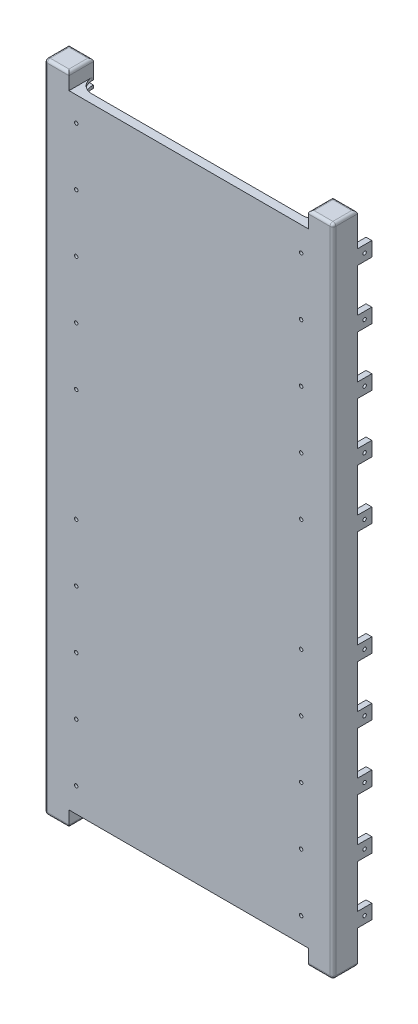
from build123d import *

# Parameters (mm, degrees)
BOSS_EXTRUDE1_DEPTH             = 227
FILLET1_R                       = 1
SKETCH2_W                       = 2
SKETCH2_H                       = 5
BOSS_EXTRUDE2_DEPTH             = 5
BOSS_EXTRUDE6_START             = -41.5
SKETCH13_W                      = 0.2
SKETCH13_H                      = 214
BOSS_EXTRUDE6_DEPTH             = 41.5
F_0_80_TAPPED_HOLE1_AT_2_COUNT  = 2
F_0_80_TAPPED_HOLE1_AT_2_PITCH  = 20
F_0_80_TAPPED_HOLE1_AT_3_COUNT  = 2
F_0_80_TAPPED_HOLE1_AT_3_PITCH  = 40
F_0_80_TAPPED_HOLE1_AT_4_COUNT  = 2
F_0_80_TAPPED_HOLE1_AT_4_PITCH  = 60
F_0_80_TAPPED_HOLE1_AT_5_COUNT  = 2
F_0_80_TAPPED_HOLE1_AT_5_PITCH  = 80
F_0_80_TAPPED_HOLE1_AT_6_COUNT  = 2
F_0_80_TAPPED_HOLE1_AT_6_PITCH  = 119
F_0_80_TAPPED_HOLE1_AT_7_COUNT  = 2
F_0_80_TAPPED_HOLE1_AT_7_PITCH  = 139
F_0_80_TAPPED_HOLE1_AT_8_COUNT  = 2
F_0_80_TAPPED_HOLE1_AT_8_PITCH  = 159
F_0_80_TAPPED_HOLE1_AT_9_COUNT  = 2
F_0_80_TAPPED_HOLE1_AT_9_PITCH  = 179
F_0_80_TAPPED_HOLE1_AT_10_COUNT = 2
F_0_80_TAPPED_HOLE1_AT_10_PITCH = 199
FILLET2_R                       = 2.5
CUT_EXTRUDE1_START              = -6.5
SKETCH3_W                       = 6.5
SKETCH3_H                       = 6.5
CUT_EXTRUDE1_DEPTH              = 214
MIRROR7_COPY_10_SKETCH_W        = 2
MIRROR7_COPY_10_SKETCH_H        = 5
MIRROR7_COPY_10_DEPTH           = 5
FILLET1_OF_MIRROR7_R            = 1
FILLET2_OF_MIRROR7_R            = 2.5
SKETCH14_W                      = 8.5
SKETCH14_H                      = 1
BOSS_EXTRUDE7_DEPTH             = 96
CUT_EXTRUDE2_DEPTH              = 242.486800882


with BuildPart() as part:
    # Sketch1 → Boss-Extrude1 (new body)
    with BuildSketch(Plane(origin=(0, 0, 0), x_dir=(1, 0, 0), z_dir=(0, 1, 0))):
        with BuildLine():
            Line((-3.25, -4.25), (4.25, -4.25))
            Line((4.25, -4.25), (4.25, 4.25))
            Line((4.25, 4.25), (-4.25, 4.25))
            Line((-4.25, 4.25), (-4.25, -3.25))
            ThreePointArc((-4.25, -3.25), (-3.957106781, -3.957106781), (-3.25, -4.25))
        make_face()
    boss_extrude1 = extrude(amount=BOSS_EXTRUDE1_DEPTH)

    # Fillet1
    fillet1_edges = [part.edges().sort_by_distance(p)[0] for p in [
        (-4.25, 227, -0.5),
        (-3.957106781, 227, 3.957106781),
        (0.5, 227, 4.25),
        (4.25, 227, 0),
        (0.5, 0, 4.25),
        (-3.957106781, 0, 3.957106781),
        (-4.25, 0, -0.5),
        (0, 0, -4.25),
        (4.25, 0, 0),
        (0, 227, -4.25),
    ]]
    fillet(fillet1_edges, radius=FILLET1_R)

    # Sketch2 → Boss-Extrude2 (add)
    with BuildSketch(Plane(origin=(4.25, 0, 0), x_dir=(0, 0, -1), z_dir=(1, 0, 0))):
        with Locations((-3.25, 213)):
            Rectangle(SKETCH2_W, SKETCH2_H)
        with Locations((-3.25, 193)):
            Rectangle(SKETCH2_W, SKETCH2_H)
        with Locations((-3.25, 173)):
            Rectangle(SKETCH2_W, SKETCH2_H)
        with Locations((-3.25, 153)):
            Rectangle(SKETCH2_W, SKETCH2_H)
        with Locations((-3.25, 133)):
            Rectangle(SKETCH2_W, SKETCH2_H)
        with Locations((-3.25, 94)):
            Rectangle(SKETCH2_W, SKETCH2_H)
        with Locations((-3.25, 74)):
            Rectangle(SKETCH2_W, SKETCH2_H)
        with Locations((-3.25, 54)):
            Rectangle(SKETCH2_W, SKETCH2_H)
        with Locations((-3.25, 34)):
            Rectangle(SKETCH2_W, SKETCH2_H)
        with Locations((-3.25, 14)):
            Rectangle(SKETCH2_W, SKETCH2_H)
    boss_extrude2 = extrude(amount=BOSS_EXTRUDE2_DEPTH)

    # Sketch13 → Boss-Extrude6 (add)
    with BuildSketch(Plane.ZY.offset(-4.25).offset(BOSS_EXTRUDE6_START)):
        with Locations((4.15, 113.5)):
            Rectangle(SKETCH13_W, SKETCH13_H)
    boss_extrude6 = extrude(amount=BOSS_EXTRUDE6_DEPTH)

    # Sketch11 → #0-80 Tapped Hole1 (revolve, cut)
    with BuildSketch(Plane(origin=(6.75, 213, 4.25), x_dir=(0, -1, 0), z_dir=(1, 0, 0))):
        Polygon((0, 0), (0, 4.358390611), (0.59563, 4.0005), (0.59563, 0), align=None)
    f_0_80_tapped_hole1 = revolve(axis=Axis((6.75, 213, 10.6), (0, 0, -1)), mode=Mode.SUBTRACT)

    # #0-80 Tapped Hole1 at 2: #0-80 Tapped Hole1 ×2
    with Locations(*[(0, -i * F_0_80_TAPPED_HOLE1_AT_2_PITCH, 0) for i in range(1, F_0_80_TAPPED_HOLE1_AT_2_COUNT)]):
        add(f_0_80_tapped_hole1, mode=Mode.SUBTRACT)

    # #0-80 Tapped Hole1 at 3: #0-80 Tapped Hole1 ×2
    with Locations(*[(0, -i * F_0_80_TAPPED_HOLE1_AT_3_PITCH, 0) for i in range(1, F_0_80_TAPPED_HOLE1_AT_3_COUNT)]):
        add(f_0_80_tapped_hole1, mode=Mode.SUBTRACT)

    # #0-80 Tapped Hole1 at 4: #0-80 Tapped Hole1 ×2
    with Locations(*[(0, -i * F_0_80_TAPPED_HOLE1_AT_4_PITCH, 0) for i in range(1, F_0_80_TAPPED_HOLE1_AT_4_COUNT)]):
        add(f_0_80_tapped_hole1, mode=Mode.SUBTRACT)

    # #0-80 Tapped Hole1 at 5: #0-80 Tapped Hole1 ×2
    with Locations(*[(0, -i * F_0_80_TAPPED_HOLE1_AT_5_PITCH, 0) for i in range(1, F_0_80_TAPPED_HOLE1_AT_5_COUNT)]):
        add(f_0_80_tapped_hole1, mode=Mode.SUBTRACT)

    # #0-80 Tapped Hole1 at 6: #0-80 Tapped Hole1 ×2
    with Locations(*[(0, -i * F_0_80_TAPPED_HOLE1_AT_6_PITCH, 0) for i in range(1, F_0_80_TAPPED_HOLE1_AT_6_COUNT)]):
        add(f_0_80_tapped_hole1, mode=Mode.SUBTRACT)

    # #0-80 Tapped Hole1 at 7: #0-80 Tapped Hole1 ×2
    with Locations(*[(0, -i * F_0_80_TAPPED_HOLE1_AT_7_PITCH, 0) for i in range(1, F_0_80_TAPPED_HOLE1_AT_7_COUNT)]):
        add(f_0_80_tapped_hole1, mode=Mode.SUBTRACT)

    # #0-80 Tapped Hole1 at 8: #0-80 Tapped Hole1 ×2
    with Locations(*[(0, -i * F_0_80_TAPPED_HOLE1_AT_8_PITCH, 0) for i in range(1, F_0_80_TAPPED_HOLE1_AT_8_COUNT)]):
        add(f_0_80_tapped_hole1, mode=Mode.SUBTRACT)

    # #0-80 Tapped Hole1 at 9: #0-80 Tapped Hole1 ×2
    with Locations(*[(0, -i * F_0_80_TAPPED_HOLE1_AT_9_PITCH, 0) for i in range(1, F_0_80_TAPPED_HOLE1_AT_9_COUNT)]):
        add(f_0_80_tapped_hole1, mode=Mode.SUBTRACT)

    # #0-80 Tapped Hole1 at 10: #0-80 Tapped Hole1 ×2
    with Locations(*[(0, -i * F_0_80_TAPPED_HOLE1_AT_10_PITCH, 0) for i in range(1, F_0_80_TAPPED_HOLE1_AT_10_COUNT)]):
        add(f_0_80_tapped_hole1, mode=Mode.SUBTRACT)

    # Fillet2
    fillet2_edges = [part.edges().sort_by_distance(p)[0] for p in [
        (4.25, 215.5, 3.15),
    ]]
    fillet(fillet2_edges, radius=FILLET2_R)
    fillet2_2_edges = [part.edges().sort_by_distance(p)[0] for p in [
        (4.25, 195.5, 3.15),
    ]]
    fillet(fillet2_2_edges, radius=FILLET2_R)
    fillet2_3_edges = [part.edges().sort_by_distance(p)[0] for p in [
        (4.25, 175.5, 3.15),
    ]]
    fillet(fillet2_3_edges, radius=FILLET2_R)
    fillet2_4_edges = [part.edges().sort_by_distance(p)[0] for p in [
        (4.25, 155.5, 3.15),
    ]]
    fillet(fillet2_4_edges, radius=FILLET2_R)
    fillet2_5_edges = [part.edges().sort_by_distance(p)[0] for p in [
        (4.25, 135.5, 3.15),
    ]]
    fillet(fillet2_5_edges, radius=FILLET2_R)
    fillet2_6_edges = [part.edges().sort_by_distance(p)[0] for p in [
        (4.25, 91.5, 3.15),
    ]]
    fillet(fillet2_6_edges, radius=FILLET2_R)
    fillet2_7_edges = [part.edges().sort_by_distance(p)[0] for p in [
        (4.25, 71.5, 3.15),
    ]]
    fillet(fillet2_7_edges, radius=FILLET2_R)
    fillet2_8_edges = [part.edges().sort_by_distance(p)[0] for p in [
        (4.25, 51.5, 3.15),
    ]]
    fillet(fillet2_8_edges, radius=FILLET2_R)
    fillet2_9_edges = [part.edges().sort_by_distance(p)[0] for p in [
        (4.25, 31.5, 3.15),
    ]]
    fillet(fillet2_9_edges, radius=FILLET2_R)
    fillet2_10_edges = [part.edges().sort_by_distance(p)[0] for p in [
        (4.25, 11.5, 3.15),
    ]]
    fillet(fillet2_10_edges, radius=FILLET2_R)
    fillet2_11_edges = [part.edges().sort_by_distance(p)[0] for p in [
        (9.25, 215.5, 3.15),
    ]]
    fillet(fillet2_11_edges, radius=FILLET2_R - 0.0001)  # a hair under: the kernel refuses the full size
    fillet2_12_edges = [part.edges().sort_by_distance(p)[0] for p in [
        (9.25, 195.5, 3.15),
    ]]
    fillet(fillet2_12_edges, radius=FILLET2_R - 0.0001)  # a hair under: the kernel refuses the full size
    fillet2_13_edges = [part.edges().sort_by_distance(p)[0] for p in [
        (9.25, 175.5, 3.15),
    ]]
    fillet(fillet2_13_edges, radius=FILLET2_R - 0.0001)  # a hair under: the kernel refuses the full size
    fillet2_14_edges = [part.edges().sort_by_distance(p)[0] for p in [
        (9.25, 155.5, 3.15),
    ]]
    fillet(fillet2_14_edges, radius=FILLET2_R - 0.0001)  # a hair under: the kernel refuses the full size
    fillet2_15_edges = [part.edges().sort_by_distance(p)[0] for p in [
        (9.25, 135.5, 3.15),
    ]]
    fillet(fillet2_15_edges, radius=FILLET2_R - 0.0001)  # a hair under: the kernel refuses the full size
    fillet2_16_edges = [part.edges().sort_by_distance(p)[0] for p in [
        (9.25, 91.5, 3.15),
    ]]
    fillet(fillet2_16_edges, radius=FILLET2_R - 0.0001)  # a hair under: the kernel refuses the full size
    fillet2_17_edges = [part.edges().sort_by_distance(p)[0] for p in [
        (9.25, 71.5, 3.15),
    ]]
    fillet(fillet2_17_edges, radius=FILLET2_R - 0.0001)  # a hair under: the kernel refuses the full size
    fillet2_18_edges = [part.edges().sort_by_distance(p)[0] for p in [
        (9.25, 51.5, 3.15),
    ]]
    fillet(fillet2_18_edges, radius=FILLET2_R - 0.0001)  # a hair under: the kernel refuses the full size
    fillet2_19_edges = [part.edges().sort_by_distance(p)[0] for p in [
        (9.25, 31.5, 3.15),
    ]]
    fillet(fillet2_19_edges, radius=FILLET2_R - 0.0001)  # a hair under: the kernel refuses the full size
    fillet2_20_edges = [part.edges().sort_by_distance(p)[0] for p in [
        (9.25, 11.5, 3.15),
    ]]
    fillet(fillet2_20_edges, radius=FILLET2_R - 0.0001)  # a hair under: the kernel refuses the full size

    # Mirror1: Boss-Extrude2, #0-80 Tapped Hole1 across plane
    add(boss_extrude2.mirror(Plane(origin=(0, 0, 0), x_dir=(-0.7071067811865478, 0, 0.7071067811865472), z_dir=(-0.7071067811865475, 0, -0.7071067811865477))))
    add(f_0_80_tapped_hole1.mirror(Plane(origin=(0, 0, 0), x_dir=(-0.7071067811865478, 0, 0.7071067811865472), z_dir=(-0.7071067811865475, 0, -0.7071067811865477))), mode=Mode.SUBTRACT)

    # Mirror1 copy 1 sketch → Mirror1 copy 1 (revolve, cut)
    with BuildSketch(Plane(origin=(-4.25, 193, -6.75), x_dir=(0, -1, 0), z_dir=(0, 0, -1))):
        Polygon((0, 0), (0, -4.358390611), (0.59563, -4.0005), (0.59563, 0), align=None)
    revolve(axis=Axis((-10.6, 193, -6.75), (-1, 0, 0)), mode=Mode.SUBTRACT)

    # Mirror1 copy 2 sketch → Mirror1 copy 2 (revolve, cut)
    with BuildSketch(Plane(origin=(-4.25, 173, -6.75), x_dir=(0, -1, 0), z_dir=(0, 0, -1))):
        Polygon((0, 0), (0, -4.358390611), (0.59563, -4.0005), (0.59563, 0), align=None)
    revolve(axis=Axis((-10.6, 173, -6.75), (-1, 0, 0)), mode=Mode.SUBTRACT)

    # Mirror1 copy 3 sketch → Mirror1 copy 3 (revolve, cut)
    with BuildSketch(Plane(origin=(-4.25, 153, -6.75), x_dir=(0, -1, 0), z_dir=(0, 0, -1))):
        Polygon((0, 0), (0, -4.358390611), (0.59563, -4.0005), (0.59563, 0), align=None)
    revolve(axis=Axis((-10.6, 153, -6.75), (-1, 0, 0)), mode=Mode.SUBTRACT)

    # Mirror1 copy 4 sketch → Mirror1 copy 4 (revolve, cut)
    with BuildSketch(Plane(origin=(-4.25, 133, -6.75), x_dir=(0, -1, 0), z_dir=(0, 0, -1))):
        Polygon((0, 0), (0, -4.358390611), (0.59563, -4.0005), (0.59563, 0), align=None)
    revolve(axis=Axis((-10.6, 133, -6.75), (-1, 0, 0)), mode=Mode.SUBTRACT)

    # Mirror1 copy 5 sketch → Mirror1 copy 5 (revolve, cut)
    with BuildSketch(Plane(origin=(-4.25, 94, -6.75), x_dir=(0, -1, 0), z_dir=(0, 0, -1))):
        Polygon((0, 0), (0, -4.358390611), (0.59563, -4.0005), (0.59563, 0), align=None)
    revolve(axis=Axis((-10.6, 94, -6.75), (-1, 0, 0)), mode=Mode.SUBTRACT)

    # Mirror1 copy 6 sketch → Mirror1 copy 6 (revolve, cut)
    with BuildSketch(Plane(origin=(-4.25, 74, -6.75), x_dir=(0, -1, 0), z_dir=(0, 0, -1))):
        Polygon((0, 0), (0, -4.358390611), (0.59563, -4.0005), (0.59563, 0), align=None)
    revolve(axis=Axis((-10.6, 74, -6.75), (-1, 0, 0)), mode=Mode.SUBTRACT)

    # Mirror1 copy 7 sketch → Mirror1 copy 7 (revolve, cut)
    with BuildSketch(Plane(origin=(-4.25, 54, -6.75), x_dir=(0, -1, 0), z_dir=(0, 0, -1))):
        Polygon((0, 0), (0, -4.358390611), (0.59563, -4.0005), (0.59563, 0), align=None)
    revolve(axis=Axis((-10.6, 54, -6.75), (-1, 0, 0)), mode=Mode.SUBTRACT)

    # Mirror1 copy 8 sketch → Mirror1 copy 8 (revolve, cut)
    with BuildSketch(Plane(origin=(-4.25, 34, -6.75), x_dir=(0, -1, 0), z_dir=(0, 0, -1))):
        Polygon((0, 0), (0, -4.358390611), (0.59563, -4.0005), (0.59563, 0), align=None)
    revolve(axis=Axis((-10.6, 34, -6.75), (-1, 0, 0)), mode=Mode.SUBTRACT)

    # Mirror1 copy 9 sketch → Mirror1 copy 9 (revolve, cut)
    with BuildSketch(Plane(origin=(-4.25, 14, -6.75), x_dir=(0, -1, 0), z_dir=(0, 0, -1))):
        Polygon((0, 0), (0, -4.358390611), (0.59563, -4.0005), (0.59563, 0), align=None)
    revolve(axis=Axis((-10.6, 14, -6.75), (-1, 0, 0)), mode=Mode.SUBTRACT)

    # Sketch3 → Cut-Extrude1 (cut)
    with BuildSketch(Plane(origin=(0, 227, 0), x_dir=(1, 0, 0), z_dir=(0, 1, 0)).offset(CUT_EXTRUDE1_START)):
        with Locations((1, 1)):
            Rectangle(SKETCH3_W, SKETCH3_H)
    cut_extrude1 = extrude(amount=-CUT_EXTRUDE1_DEPTH, mode=Mode.SUBTRACT)

    # Mirror7: Boss-Extrude1, Boss-Extrude2, Boss-Extrude6, #0-80 Tapped Hole1, Cut-Extrude1 across plane
    add(boss_extrude1.mirror(Plane.ZY.offset(-45.75)))
    add(boss_extrude2.mirror(Plane.ZY.offset(-45.75)))
    add(boss_extrude6.mirror(Plane.ZY.offset(-45.75)))
    add(f_0_80_tapped_hole1.mirror(Plane.ZY.offset(-45.75)), mode=Mode.SUBTRACT)
    add(cut_extrude1.mirror(Plane.ZY.offset(-45.75)), mode=Mode.SUBTRACT)

    # Mirror7 copy 1 sketch → Mirror7 copy 1 (revolve, cut)
    with BuildSketch(Plane(origin=(84.75, 193, 4.25), x_dir=(0, -1, 0), z_dir=(-1, 0, 0))):
        Polygon((0, 0), (0, -4.358390611), (0.59563, -4.0005), (0.59563, 0), align=None)
    revolve(axis=Axis((84.75, 193, 10.6), (0, 0, 1)), mode=Mode.SUBTRACT)

    # Mirror7 copy 2 sketch → Mirror7 copy 2 (revolve, cut)
    with BuildSketch(Plane(origin=(84.75, 173, 4.25), x_dir=(0, -1, 0), z_dir=(-1, 0, 0))):
        Polygon((0, 0), (0, -4.358390611), (0.59563, -4.0005), (0.59563, 0), align=None)
    revolve(axis=Axis((84.75, 173, 10.6), (0, 0, 1)), mode=Mode.SUBTRACT)

    # Mirror7 copy 3 sketch → Mirror7 copy 3 (revolve, cut)
    with BuildSketch(Plane(origin=(84.75, 153, 4.25), x_dir=(0, -1, 0), z_dir=(-1, 0, 0))):
        Polygon((0, 0), (0, -4.358390611), (0.59563, -4.0005), (0.59563, 0), align=None)
    revolve(axis=Axis((84.75, 153, 10.6), (0, 0, 1)), mode=Mode.SUBTRACT)

    # Mirror7 copy 4 sketch → Mirror7 copy 4 (revolve, cut)
    with BuildSketch(Plane(origin=(84.75, 133, 4.25), x_dir=(0, -1, 0), z_dir=(-1, 0, 0))):
        Polygon((0, 0), (0, -4.358390611), (0.59563, -4.0005), (0.59563, 0), align=None)
    revolve(axis=Axis((84.75, 133, 10.6), (0, 0, 1)), mode=Mode.SUBTRACT)

    # Mirror7 copy 5 sketch → Mirror7 copy 5 (revolve, cut)
    with BuildSketch(Plane(origin=(84.75, 94, 4.25), x_dir=(0, -1, 0), z_dir=(-1, 0, 0))):
        Polygon((0, 0), (0, -4.358390611), (0.59563, -4.0005), (0.59563, 0), align=None)
    revolve(axis=Axis((84.75, 94, 10.6), (0, 0, 1)), mode=Mode.SUBTRACT)

    # Mirror7 copy 6 sketch → Mirror7 copy 6 (revolve, cut)
    with BuildSketch(Plane(origin=(84.75, 74, 4.25), x_dir=(0, -1, 0), z_dir=(-1, 0, 0))):
        Polygon((0, 0), (0, -4.358390611), (0.59563, -4.0005), (0.59563, 0), align=None)
    revolve(axis=Axis((84.75, 74, 10.6), (0, 0, 1)), mode=Mode.SUBTRACT)

    # Mirror7 copy 7 sketch → Mirror7 copy 7 (revolve, cut)
    with BuildSketch(Plane(origin=(84.75, 54, 4.25), x_dir=(0, -1, 0), z_dir=(-1, 0, 0))):
        Polygon((0, 0), (0, -4.358390611), (0.59563, -4.0005), (0.59563, 0), align=None)
    revolve(axis=Axis((84.75, 54, 10.6), (0, 0, 1)), mode=Mode.SUBTRACT)

    # Mirror7 copy 8 sketch → Mirror7 copy 8 (revolve, cut)
    with BuildSketch(Plane(origin=(84.75, 34, 4.25), x_dir=(0, -1, 0), z_dir=(-1, 0, 0))):
        Polygon((0, 0), (0, -4.358390611), (0.59563, -4.0005), (0.59563, 0), align=None)
    revolve(axis=Axis((84.75, 34, 10.6), (0, 0, 1)), mode=Mode.SUBTRACT)

    # Mirror7 copy 9 sketch → Mirror7 copy 9 (revolve, cut)
    with BuildSketch(Plane(origin=(84.75, 14, 4.25), x_dir=(0, -1, 0), z_dir=(-1, 0, 0))):
        Polygon((0, 0), (0, -4.358390611), (0.59563, -4.0005), (0.59563, 0), align=None)
    revolve(axis=Axis((84.75, 14, 10.6), (0, 0, 1)), mode=Mode.SUBTRACT)

    # Mirror7 copy 10 sketch → Mirror7 copy 10 (add)
    with BuildSketch(Plane(origin=(91.5, 0, -4.25), x_dir=(-1, 0, 0), z_dir=(0, 0, -1))):
        with Locations((-3.25, 213)):
            Rectangle(MIRROR7_COPY_10_SKETCH_W, MIRROR7_COPY_10_SKETCH_H)
        with Locations((-3.25, 193)):
            Rectangle(MIRROR7_COPY_10_SKETCH_W, MIRROR7_COPY_10_SKETCH_H)
        with Locations((-3.25, 173)):
            Rectangle(MIRROR7_COPY_10_SKETCH_W, MIRROR7_COPY_10_SKETCH_H)
        with Locations((-3.25, 153)):
            Rectangle(MIRROR7_COPY_10_SKETCH_W, MIRROR7_COPY_10_SKETCH_H)
        with Locations((-3.25, 133)):
            Rectangle(MIRROR7_COPY_10_SKETCH_W, MIRROR7_COPY_10_SKETCH_H)
        with Locations((-3.25, 94)):
            Rectangle(MIRROR7_COPY_10_SKETCH_W, MIRROR7_COPY_10_SKETCH_H)
        with Locations((-3.25, 74)):
            Rectangle(MIRROR7_COPY_10_SKETCH_W, MIRROR7_COPY_10_SKETCH_H)
        with Locations((-3.25, 54)):
            Rectangle(MIRROR7_COPY_10_SKETCH_W, MIRROR7_COPY_10_SKETCH_H)
        with Locations((-3.25, 34)):
            Rectangle(MIRROR7_COPY_10_SKETCH_W, MIRROR7_COPY_10_SKETCH_H)
        with Locations((-3.25, 14)):
            Rectangle(MIRROR7_COPY_10_SKETCH_W, MIRROR7_COPY_10_SKETCH_H)
    extrude(amount=MIRROR7_COPY_10_DEPTH)

    # Mirror7 copy 11 sketch → Mirror7 copy 11 (revolve, cut)
    with BuildSketch(Plane(origin=(95.75, 213, -6.75), x_dir=(0, -1, 0), z_dir=(0, 0, -1))):
        Polygon((0, 0), (0, 4.358390611), (0.59563, 4.0005), (0.59563, 0), align=None)
    revolve(axis=Axis((102.1, 213, -6.75), (-1, 0, 0)), mode=Mode.SUBTRACT)

    # Mirror7 copy 12 sketch → Mirror7 copy 12 (revolve, cut)
    with BuildSketch(Plane(origin=(95.75, 193, -6.75), x_dir=(0, -1, 0), z_dir=(0, 0, -1))):
        Polygon((0, 0), (0, 4.358390611), (0.59563, 4.0005), (0.59563, 0), align=None)
    revolve(axis=Axis((102.1, 193, -6.75), (-1, 0, 0)), mode=Mode.SUBTRACT)

    # Mirror7 copy 13 sketch → Mirror7 copy 13 (revolve, cut)
    with BuildSketch(Plane(origin=(95.75, 173, -6.75), x_dir=(0, -1, 0), z_dir=(0, 0, -1))):
        Polygon((0, 0), (0, 4.358390611), (0.59563, 4.0005), (0.59563, 0), align=None)
    revolve(axis=Axis((102.1, 173, -6.75), (-1, 0, 0)), mode=Mode.SUBTRACT)

    # Mirror7 copy 14 sketch → Mirror7 copy 14 (revolve, cut)
    with BuildSketch(Plane(origin=(95.75, 153, -6.75), x_dir=(0, -1, 0), z_dir=(0, 0, -1))):
        Polygon((0, 0), (0, 4.358390611), (0.59563, 4.0005), (0.59563, 0), align=None)
    revolve(axis=Axis((102.1, 153, -6.75), (-1, 0, 0)), mode=Mode.SUBTRACT)

    # Mirror7 copy 15 sketch → Mirror7 copy 15 (revolve, cut)
    with BuildSketch(Plane(origin=(95.75, 133, -6.75), x_dir=(0, -1, 0), z_dir=(0, 0, -1))):
        Polygon((0, 0), (0, 4.358390611), (0.59563, 4.0005), (0.59563, 0), align=None)
    revolve(axis=Axis((102.1, 133, -6.75), (-1, 0, 0)), mode=Mode.SUBTRACT)

    # Mirror7 copy 16 sketch → Mirror7 copy 16 (revolve, cut)
    with BuildSketch(Plane(origin=(95.75, 94, -6.75), x_dir=(0, -1, 0), z_dir=(0, 0, -1))):
        Polygon((0, 0), (0, 4.358390611), (0.59563, 4.0005), (0.59563, 0), align=None)
    revolve(axis=Axis((102.1, 94, -6.75), (-1, 0, 0)), mode=Mode.SUBTRACT)

    # Mirror7 copy 17 sketch → Mirror7 copy 17 (revolve, cut)
    with BuildSketch(Plane(origin=(95.75, 74, -6.75), x_dir=(0, -1, 0), z_dir=(0, 0, -1))):
        Polygon((0, 0), (0, 4.358390611), (0.59563, 4.0005), (0.59563, 0), align=None)
    revolve(axis=Axis((102.1, 74, -6.75), (-1, 0, 0)), mode=Mode.SUBTRACT)

    # Mirror7 copy 18 sketch → Mirror7 copy 18 (revolve, cut)
    with BuildSketch(Plane(origin=(95.75, 54, -6.75), x_dir=(0, -1, 0), z_dir=(0, 0, -1))):
        Polygon((0, 0), (0, 4.358390611), (0.59563, 4.0005), (0.59563, 0), align=None)
    revolve(axis=Axis((102.1, 54, -6.75), (-1, 0, 0)), mode=Mode.SUBTRACT)

    # Mirror7 copy 19 sketch → Mirror7 copy 19 (revolve, cut)
    with BuildSketch(Plane(origin=(95.75, 34, -6.75), x_dir=(0, -1, 0), z_dir=(0, 0, -1))):
        Polygon((0, 0), (0, 4.358390611), (0.59563, 4.0005), (0.59563, 0), align=None)
    revolve(axis=Axis((102.1, 34, -6.75), (-1, 0, 0)), mode=Mode.SUBTRACT)

    # Mirror7 copy 20 sketch → Mirror7 copy 20 (revolve, cut)
    with BuildSketch(Plane(origin=(95.75, 14, -6.75), x_dir=(0, -1, 0), z_dir=(0, 0, -1))):
        Polygon((0, 0), (0, 4.358390611), (0.59563, 4.0005), (0.59563, 0), align=None)
    revolve(axis=Axis((102.1, 14, -6.75), (-1, 0, 0)), mode=Mode.SUBTRACT)

    # Fillet1 of Mirror7
    fillet1_of_mirror7_edges = [part.edges().sort_by_distance(p)[0] for p in [
        (95.75, 227, -0.5),
        (95.457106781, 227, 3.957106781),
        (91, 227, 4.25),
        (87.25, 227, 0),
        (91, 0, 4.25),
        (95.457106781, 0, 3.957106781),
        (95.75, 0, -0.5),
        (91.5, 0, -4.25),
        (87.25, 0, 0),
        (91.5, 227, -4.25),
    ]]
    fillet(fillet1_of_mirror7_edges, radius=FILLET1_OF_MIRROR7_R)

    # Fillet2 of Mirror7
    fillet2_of_mirror7_edges = [part.edges().sort_by_distance(p)[0] for p in [
        (87.25, 11.5, 3.15),
    ]]
    fillet(fillet2_of_mirror7_edges, radius=FILLET2_OF_MIRROR7_R)
    fillet2_of_mirror7_2_edges = [part.edges().sort_by_distance(p)[0] for p in [
        (87.25, 215.5, 3.15),
    ]]
    fillet(fillet2_of_mirror7_2_edges, radius=FILLET2_OF_MIRROR7_R)
    fillet2_of_mirror7_3_edges = [part.edges().sort_by_distance(p)[0] for p in [
        (82.25, 11.5, 3.15),
    ]]
    fillet(fillet2_of_mirror7_3_edges, radius=FILLET2_OF_MIRROR7_R - 0.0001)  # a hair under: the kernel refuses the full size
    fillet2_of_mirror7_4_edges = [part.edges().sort_by_distance(p)[0] for p in [
        (82.25, 215.5, 3.15),
    ]]
    fillet(fillet2_of_mirror7_4_edges, radius=FILLET2_OF_MIRROR7_R - 0.0001)  # a hair under: the kernel refuses the full size
    fillet2_of_mirror7_5_edges = [part.edges().sort_by_distance(p)[0] for p in [
        (87.25, 195.5, 3.15),
    ]]
    fillet(fillet2_of_mirror7_5_edges, radius=FILLET2_OF_MIRROR7_R)
    fillet2_of_mirror7_6_edges = [part.edges().sort_by_distance(p)[0] for p in [
        (87.25, 31.5, 3.15),
    ]]
    fillet(fillet2_of_mirror7_6_edges, radius=FILLET2_OF_MIRROR7_R)
    fillet2_of_mirror7_7_edges = [part.edges().sort_by_distance(p)[0] for p in [
        (82.25, 195.5, 3.15),
    ]]
    fillet(fillet2_of_mirror7_7_edges, radius=FILLET2_OF_MIRROR7_R - 0.0001)  # a hair under: the kernel refuses the full size
    fillet2_of_mirror7_8_edges = [part.edges().sort_by_distance(p)[0] for p in [
        (82.25, 31.5, 3.15),
    ]]
    fillet(fillet2_of_mirror7_8_edges, radius=FILLET2_OF_MIRROR7_R - 0.0001)  # a hair under: the kernel refuses the full size
    fillet2_of_mirror7_9_edges = [part.edges().sort_by_distance(p)[0] for p in [
        (87.25, 175.5, 3.15),
    ]]
    fillet(fillet2_of_mirror7_9_edges, radius=FILLET2_OF_MIRROR7_R)
    fillet2_of_mirror7_10_edges = [part.edges().sort_by_distance(p)[0] for p in [
        (87.25, 51.5, 3.15),
    ]]
    fillet(fillet2_of_mirror7_10_edges, radius=FILLET2_OF_MIRROR7_R)
    fillet2_of_mirror7_11_edges = [part.edges().sort_by_distance(p)[0] for p in [
        (82.25, 175.5, 3.15),
    ]]
    fillet(fillet2_of_mirror7_11_edges, radius=FILLET2_OF_MIRROR7_R - 0.0001)  # a hair under: the kernel refuses the full size
    fillet2_of_mirror7_12_edges = [part.edges().sort_by_distance(p)[0] for p in [
        (82.25, 51.5, 3.15),
    ]]
    fillet(fillet2_of_mirror7_12_edges, radius=FILLET2_OF_MIRROR7_R - 0.0001)  # a hair under: the kernel refuses the full size
    fillet2_of_mirror7_13_edges = [part.edges().sort_by_distance(p)[0] for p in [
        (87.25, 155.5, 3.15),
    ]]
    fillet(fillet2_of_mirror7_13_edges, radius=FILLET2_OF_MIRROR7_R)
    fillet2_of_mirror7_14_edges = [part.edges().sort_by_distance(p)[0] for p in [
        (87.25, 71.5, 3.15),
    ]]
    fillet(fillet2_of_mirror7_14_edges, radius=FILLET2_OF_MIRROR7_R)
    fillet2_of_mirror7_15_edges = [part.edges().sort_by_distance(p)[0] for p in [
        (82.25, 155.5, 3.15),
    ]]
    fillet(fillet2_of_mirror7_15_edges, radius=FILLET2_OF_MIRROR7_R - 0.0001)  # a hair under: the kernel refuses the full size
    fillet2_of_mirror7_16_edges = [part.edges().sort_by_distance(p)[0] for p in [
        (82.25, 71.5, 3.15),
    ]]
    fillet(fillet2_of_mirror7_16_edges, radius=FILLET2_OF_MIRROR7_R - 0.0001)  # a hair under: the kernel refuses the full size
    fillet2_of_mirror7_17_edges = [part.edges().sort_by_distance(p)[0] for p in [
        (87.25, 135.5, 3.15),
    ]]
    fillet(fillet2_of_mirror7_17_edges, radius=FILLET2_OF_MIRROR7_R)
    fillet2_of_mirror7_18_edges = [part.edges().sort_by_distance(p)[0] for p in [
        (87.25, 91.5, 3.15),
    ]]
    fillet(fillet2_of_mirror7_18_edges, radius=FILLET2_OF_MIRROR7_R)
    fillet2_of_mirror7_19_edges = [part.edges().sort_by_distance(p)[0] for p in [
        (82.25, 135.5, 3.15),
    ]]
    fillet(fillet2_of_mirror7_19_edges, radius=FILLET2_OF_MIRROR7_R - 0.0001)  # a hair under: the kernel refuses the full size
    fillet2_of_mirror7_20_edges = [part.edges().sort_by_distance(p)[0] for p in [
        (82.25, 91.5, 3.15),
    ]]
    fillet(fillet2_of_mirror7_20_edges, radius=FILLET2_OF_MIRROR7_R - 0.0001)  # a hair under: the kernel refuses the full size

    # Sketch14 → Boss-Extrude7 (add)
    with BuildSketch(Plane(origin=(-2.25, 0, 0), x_dir=(0, 0, -1), z_dir=(1, 0, 0))):
        with Locations((0, 8.55)):
            Rectangle(SKETCH14_W, SKETCH14_H)
        with Locations((0, 18.55)):
            Rectangle(SKETCH14_W, SKETCH14_H)
        with Locations((0, 6)):
            Rectangle(SKETCH14_W, SKETCH14_H)
        with Locations((0, 16)):
            Rectangle(SKETCH14_W, SKETCH14_H)
        with Locations((0, 28.55)):
            Rectangle(SKETCH14_W, SKETCH14_H)
        with Locations((0, 26)):
            Rectangle(SKETCH14_W, SKETCH14_H)
        with Locations((0, 38.55)):
            Rectangle(SKETCH14_W, SKETCH14_H)
        with Locations((0, 36)):
            Rectangle(SKETCH14_W, SKETCH14_H)
        with Locations((0, 48.55)):
            Rectangle(SKETCH14_W, SKETCH14_H)
        with Locations((0, 46)):
            Rectangle(SKETCH14_W, SKETCH14_H)
        with Locations((0, 58.55)):
            Rectangle(SKETCH14_W, SKETCH14_H)
        with Locations((0, 56)):
            Rectangle(SKETCH14_W, SKETCH14_H)
        with Locations((0, 68.55)):
            Rectangle(SKETCH14_W, SKETCH14_H)
        with Locations((0, 66)):
            Rectangle(SKETCH14_W, SKETCH14_H)
        with Locations((0, 78.55)):
            Rectangle(SKETCH14_W, SKETCH14_H)
        with Locations((0, 76)):
            Rectangle(SKETCH14_W, SKETCH14_H)
        with Locations((0, 88.55)):
            Rectangle(SKETCH14_W, SKETCH14_H)
        with Locations((0, 86)):
            Rectangle(SKETCH14_W, SKETCH14_H)
        with Locations((0, 98.55)):
            Rectangle(SKETCH14_W, SKETCH14_H)
        with Locations((0, 96)):
            Rectangle(SKETCH14_W, SKETCH14_H)
        with Locations((0, 108.55)):
            Rectangle(SKETCH14_W, SKETCH14_H)
        with Locations((0, 106)):
            Rectangle(SKETCH14_W, SKETCH14_H)
        with Locations((0, 121)):
            Rectangle(SKETCH14_W, SKETCH14_H)
        with Locations((0, 118.45)):
            Rectangle(SKETCH14_W, SKETCH14_H)
        with Locations((0, 131)):
            Rectangle(SKETCH14_W, SKETCH14_H)
        with Locations((0, 128.45)):
            Rectangle(SKETCH14_W, SKETCH14_H)
        with Locations((0, 141)):
            Rectangle(SKETCH14_W, SKETCH14_H)
        with Locations((0, 138.45)):
            Rectangle(SKETCH14_W, SKETCH14_H)
        with Locations((0, 151)):
            Rectangle(SKETCH14_W, SKETCH14_H)
        with Locations((0, 148.45)):
            Rectangle(SKETCH14_W, SKETCH14_H)
        with Locations((0, 161)):
            Rectangle(SKETCH14_W, SKETCH14_H)
        with Locations((0, 158.45)):
            Rectangle(SKETCH14_W, SKETCH14_H)
        with Locations((0, 171)):
            Rectangle(SKETCH14_W, SKETCH14_H)
        with Locations((0, 168.45)):
            Rectangle(SKETCH14_W, SKETCH14_H)
        with Locations((0, 181)):
            Rectangle(SKETCH14_W, SKETCH14_H)
        with Locations((0, 178.45)):
            Rectangle(SKETCH14_W, SKETCH14_H)
        with Locations((0, 191)):
            Rectangle(SKETCH14_W, SKETCH14_H)
        with Locations((0, 188.45)):
            Rectangle(SKETCH14_W, SKETCH14_H)
        with Locations((0, 201)):
            Rectangle(SKETCH14_W, SKETCH14_H)
        with Locations((0, 198.45)):
            Rectangle(SKETCH14_W, SKETCH14_H)
        with Locations((0, 211)):
            Rectangle(SKETCH14_W, SKETCH14_H)
        with Locations((0, 208.45)):
            Rectangle(SKETCH14_W, SKETCH14_H)
        with Locations((0, 221)):
            Rectangle(SKETCH14_W, SKETCH14_H)
        with Locations((0, 218.45)):
            Rectangle(SKETCH14_W, SKETCH14_H)
    extrude(amount=BOSS_EXTRUDE7_DEPTH)

    # Sketch15 → Cut-Extrude2 (cut, through all)
    with BuildSketch(Plane.XZ.offset(-5.5)):
        with BuildLine():
            Line((4.25, -4.25), (4.25, -3.75))
            ThreePointArc((4.25, -3.75), (5.714466094, -0.214466094), (9.25, 1.25))
            Line((9.25, 1.25), (82.25, 1.25))
            ThreePointArc((82.25, 1.25), (85.785533906, -0.214466094), (87.25, -3.75))
            Line((87.25, -3.75), (87.25, -4.25))
            Line((87.25, -4.25), (4.25, -4.25))
        make_face()
    extrude(amount=-CUT_EXTRUDE2_DEPTH, mode=Mode.SUBTRACT)


solid = part.part
